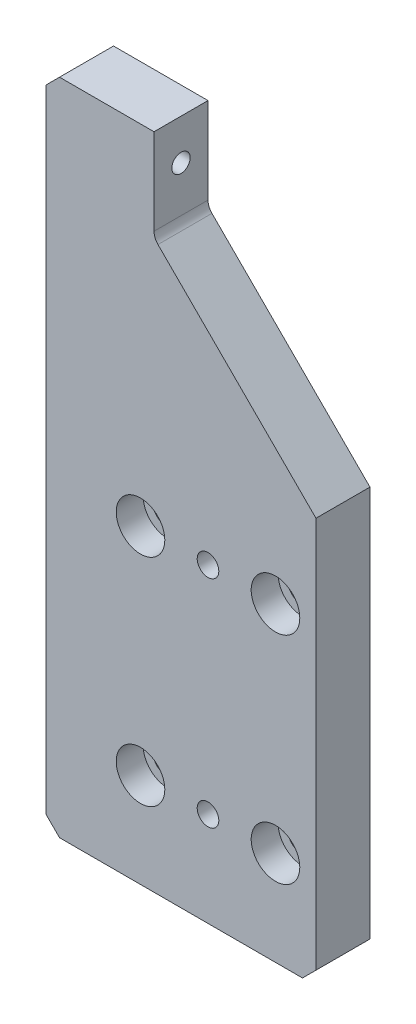
from build123d import *

# Parameters (mm, degrees)
SKETCH_3_W                    = 20
SKETCH_3_H                    = 244
EXTRUDE_1_DEPTH               = 50
SKETCH_4_W                    = 60
SKETCH_4_H                    = 20
CUT_EXTRUDE_1_DEPTH           = 34
HOLE_WIZARD_M8_1_D            = 6.8
CHAMFER_1_SIZE                = 60
CHAMFER_2_SIZE                = 5
HOLE_WIZARD_M10_1_D           = 11
HOLE_WIZARD_M10_1_CBORE_D     = 18
HOLE_WIZARD_M10_1_CBORE_DEPTH = 10
HOLE_WIZARD_8_0_8_1_D         = 8
FILLET_1_DEPTH                = 20


with BuildPart() as part:
    # 草圖3 → 伸長1 (new, symmetric)
    with BuildSketch(Plane(origin=(0, 0, 0), x_dir=(0, 0, -1), z_dir=(1, 0, 0))):
        with Locations((-10, -122)):
            Rectangle(SKETCH_3_W, SKETCH_3_H)
    extrude(amount=EXTRUDE_1_DEPTH, both=True)

    # 草圖4 → 除料-伸長1 (cut)
    with BuildSketch(Plane(origin=(0, 0, 0), x_dir=(1, 0, 0), z_dir=(0, 1, 0))):
        with Locations((20, -10)):
            Rectangle(SKETCH_4_W, SKETCH_4_H)
    extrude(amount=-CUT_EXTRUDE_1_DEPTH, mode=Mode.SUBTRACT)

    # M8 螺紋孔1 (through all)
    with Locations(Plane(origin=(-10, -84.062632567, -21.444178573), x_dir=(0, 0, 1), z_dir=(1, 0, 0))):
        with Locations((31.444178573, -69.062632567)):
            Hole(HOLE_WIZARD_M8_1_D / 2)

    # 導角1
    chamfer_1_edges = [part.edges().sort_by_distance(p)[0] for p in [
        (50, -34, 10),
    ]]
    chamfer(chamfer_1_edges, length=CHAMFER_1_SIZE - 0.0001)  # a hair under: the kernel refuses the full size

    # 導角2
    chamfer_2_edges = [part.edges().sort_by_distance(p)[0] for p in [
        (-50, 0, 10),
        (-50, -244, 10),
        (50, -244, 10),
    ]]
    chamfer(chamfer_2_edges, length=CHAMFER_2_SIZE)

    # M10 六角承窩頭蓋螺釘的柱孔1 (through all)
    with Locations(Plane.XY.offset(20)):
        with Locations((-15, -129), (35, -129), (-15, -209), (35, -209)):
            CounterBoreHole(HOLE_WIZARD_M10_1_D / 2, HOLE_WIZARD_M10_1_CBORE_D / 2, HOLE_WIZARD_M10_1_CBORE_DEPTH)

    # Ø8.0 (8) 直徑孔1 (through all)
    with Locations(Plane.XY.offset(20)):
        with Locations((10, -129), (10, -209)):
            Hole(HOLE_WIZARD_8_0_8_1_D / 2)

    # 圓角1: read off the stored shape, not the designer's step
    # 圓角1 outline → 圓角1 (add)
    with BuildSketch(Plane.XY):
        with BuildLine():
            ThreePointArc((-8.535533906, -35.464466094), (-9.619397663, -33.84234935), (-10, -31.928932188))
            Line((-10, -31.928932188), (-10, -34))
            Line((-10, -34), (-8.535533906, -35.464466094))
        make_face()
    extrude(amount=FILLET_1_DEPTH)


solid = part.part
